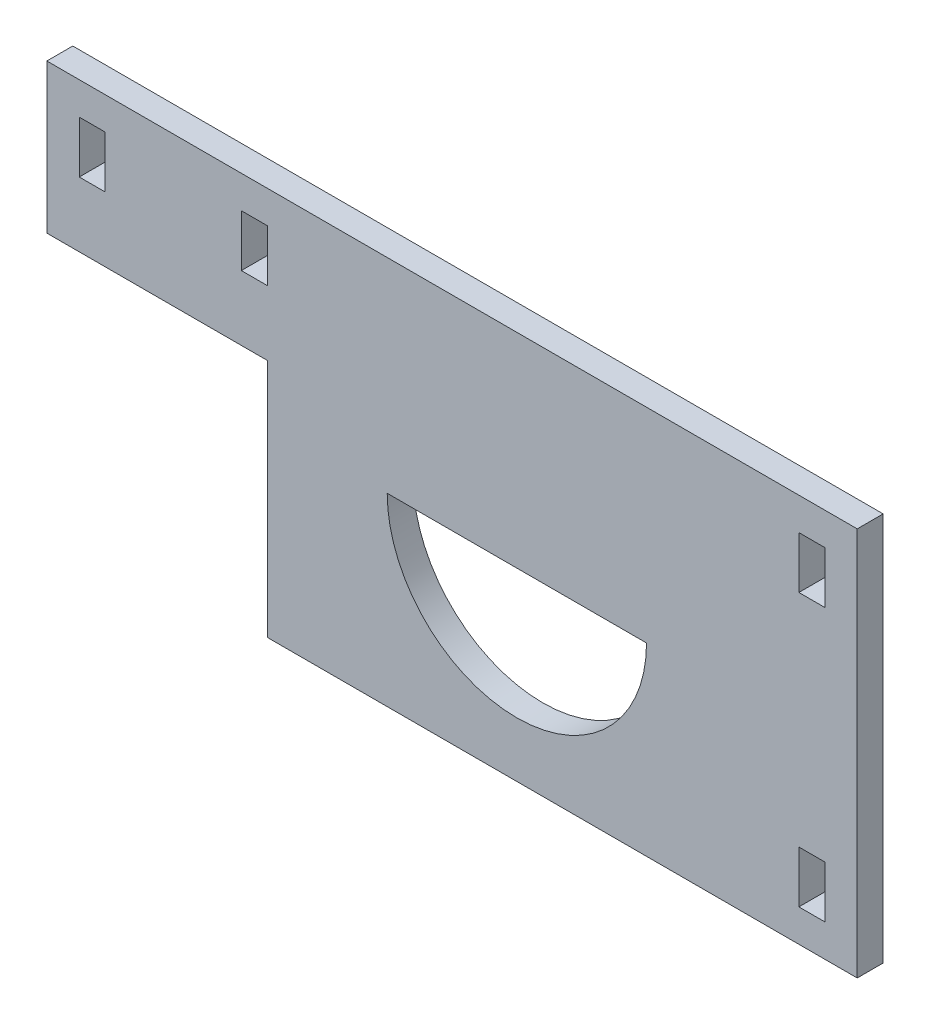
from build123d import *

# Parameters (mm, degrees)
SKETCH1_W           = 4
SKETCH1_H           = 8
BOSS_EXTRUDE1_DEPTH = 4


with BuildPart() as part:
    # Sketch1 → Boss-Extrude1 (new body)
    with BuildSketch(Plane.XY):
        Polygon((-72.5, 30), (-72.5, 7), (-38.5, 7), (-38.5, -30), (52.5, -30), (52.5, 30), align=None)
        with BuildLine():
            Line((-20, -1.498357325), (20, -1.498357325))
            ThreePointArc((20, -1.498357325), (0, -21.498357325), (-20, -1.498357325))
        make_face(mode=Mode.SUBTRACT)
        with Locations((-40.5, 21)):
            Rectangle(SKETCH1_W, SKETCH1_H, mode=Mode.SUBTRACT)
        with Locations((45.5, 21)):
            Rectangle(SKETCH1_W, SKETCH1_H, mode=Mode.SUBTRACT)
        with Locations((45.5, -21)):
            Rectangle(SKETCH1_W, SKETCH1_H, mode=Mode.SUBTRACT)
        with Locations((-65.5, 21)):
            Rectangle(SKETCH1_W, SKETCH1_H, mode=Mode.SUBTRACT)
    extrude(amount=BOSS_EXTRUDE1_DEPTH)


solid = part.part
